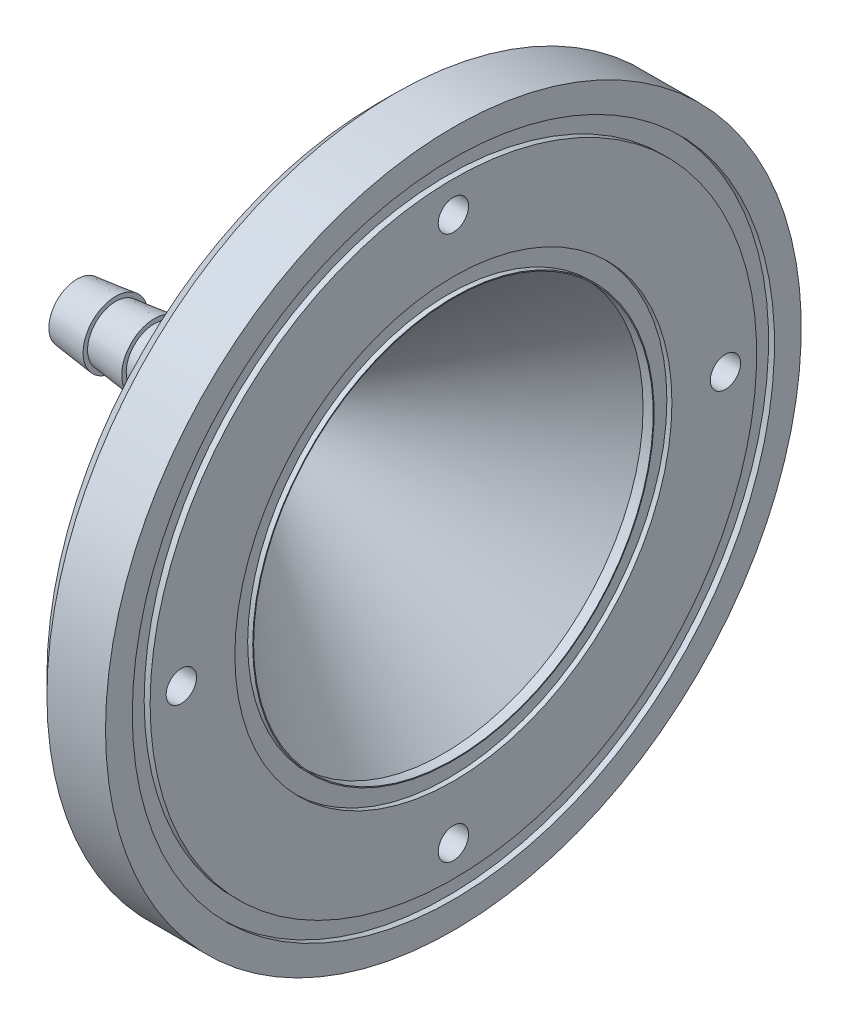
from build123d import *

# Parameters (mm, degrees)
CBORE_FOR_M3_HEX_SOCKET_HEAD_CAP_SCREW2_D           = 3.4
CBORE_FOR_M3_HEX_SOCKET_HEAD_CAP_SCREW2_DEPTH       = 8.566
CBORE_FOR_M3_HEX_SOCKET_HEAD_CAP_SCREW2_CBORE_D     = 6.5
CBORE_FOR_M3_HEX_SOCKET_HEAD_CAP_SCREW2_CBORE_DEPTH = 3.4
CBORE_FOR_M3_HEX_SOCKET_HEAD_CAP_SCREW2_TIP         = 1.021463052
CHAMFER1_SIZE                                       = 2


with BuildPart() as part:
    # Sketch1 → Revolve17 (revolve)
    with BuildSketch(Plane.XY):
        Polygon((-14.175209939, 3.15), (-14.175209939, 3.65), (-18.508543272, 3.15), (-18.508543272, 1.9), (0, 1.9), (22.555350238, 22.4), (23.687350238, 22.4), (23.687350238, 22.5), (23.121350238, 22.5), (23.121350238, 24.5), (23.687350238, 24.5), (23.687350238, 34), (23.020350238, 34), (23.020350238, 36), (23.687350238, 36), (23.687350238, 39), (15.121350238, 39), (15.121350238, 22.4), (-5.508543272, 3.65), (-9.841876606, 3.15), (-9.841876606, 3.65), align=None)
    revolve(axis=Axis((-801.920554309, 0, 0), (1, 0, 0)))

    # CBORE for M3 Hex Socket Head Cap Screw2
    with Locations(Plane.ZY.offset(-15.121350238)):
        with Locations((0, -30.5), (0, 30.5), (30.5, 0), (-30.5, 0)):
            CounterBoreHole(CBORE_FOR_M3_HEX_SOCKET_HEAD_CAP_SCREW2_D / 2, CBORE_FOR_M3_HEX_SOCKET_HEAD_CAP_SCREW2_CBORE_D / 2, CBORE_FOR_M3_HEX_SOCKET_HEAD_CAP_SCREW2_CBORE_DEPTH, depth=CBORE_FOR_M3_HEX_SOCKET_HEAD_CAP_SCREW2_DEPTH)
            with Locations((0, 0, -(CBORE_FOR_M3_HEX_SOCKET_HEAD_CAP_SCREW2_DEPTH + CBORE_FOR_M3_HEX_SOCKET_HEAD_CAP_SCREW2_TIP / 2))):  # 118° drill point
                Cone(0, CBORE_FOR_M3_HEX_SOCKET_HEAD_CAP_SCREW2_D / 2, CBORE_FOR_M3_HEX_SOCKET_HEAD_CAP_SCREW2_TIP, mode=Mode.SUBTRACT)

    # Chamfer1
    chamfer1_edges = [part.edges().sort_by_distance(p)[0] for p in [
        (15.121350238, -39, 0),
    ]]
    chamfer(chamfer1_edges, length=CHAMFER1_SIZE)


solid = part.part
